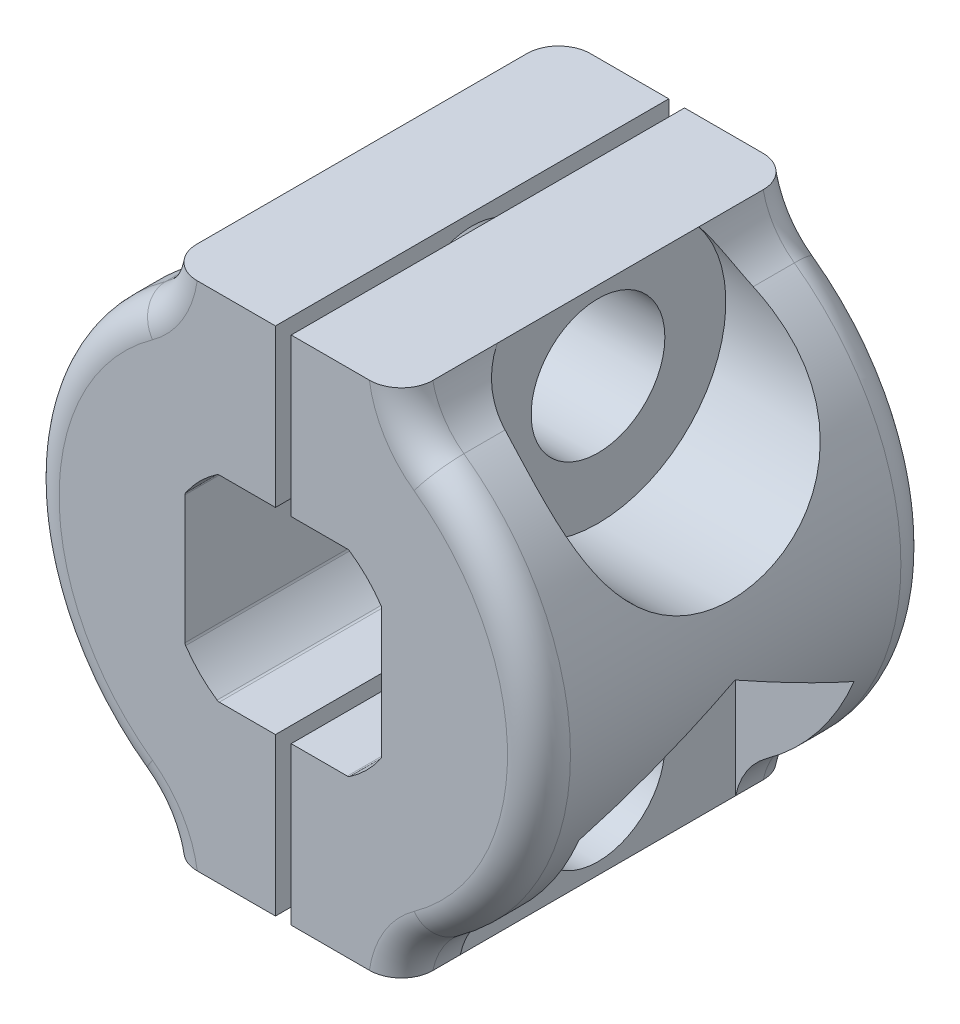
from build123d import *

# Parameters (mm, degrees)
BOSS_EXTRUDE1_DEPTH     = 6.35
CUT_EXTRUDE1_DEPTH      = 14.446415507
CUT_EXTRUDE1_DEPTH_BACK = 14.446415507
SKETCH3_R               = 2.159
CUT_EXTRUDE2_START      = -3.81
SKETCH4_R               = 2.159
CUT_EXTRUDE2_DEPTH      = 12.7
CUT_EXTRUDE3_START      = 3.81
SKETCH4_4_R             = 2.159
CUT_EXTRUDE3_DEPTH      = 12.7
SKETCH6_R               = 4.1275
CUT_EXTRUDE4_DEPTH      = 12.7
SKETCH7_R               = 4.1275
CUT_EXTRUDE5_DEPTH      = 12.7
FILLET1_R               = 2.54
FILLET2_R               = 2.54
FILLET3_R               = 1.016
FILLET4_R               = 1.016


with BuildPart() as part:
    # Sketch2 → Boss-Extrude1 (new, symmetric)
    with BuildSketch(Plane.XY):
        with BuildLine():
            Line((-0.254, 3.175), (-0.254, 8.251091382))
            ThreePointArc((-0.254, 8.251091382), (-2.084293684, 7.987536844), (-3.81, 7.323177248))
            ThreePointArc((-3.81, 7.323177248), (-8.255, 0), (-3.81, -7.323177248))
            ThreePointArc((-3.81, -7.323177248), (-2.084293684, -7.987536844), (-0.254, -8.251091382))
            Line((-0.254, -8.251091382), (-0.254, -3.175))
            Line((-0.254, -3.175), (-2.067410216, -3.175))
            ThreePointArc((-2.067410216, -3.175), (-2.1046987, -3.169402508), (-2.138700223, -3.153103448))
            ThreePointArc((-2.138700223, -3.153103448), (-2.694076836, -2.694076836), (-3.153103448, -2.138700223))
            ThreePointArc((-3.153103448, -2.138700223), (-3.169402508, -2.1046987), (-3.175, -2.067410216))
            Line((-3.175, -2.067410216), (-3.175, 0))
            Line((-3.175, 0), (-3.175, 2.067410216))
            ThreePointArc((-3.175, 2.067410216), (-3.169402508, 2.1046987), (-3.153103448, 2.138700223))
            ThreePointArc((-3.153103448, 2.138700223), (-2.694076836, 2.694076836), (-2.138700223, 3.153103448))
            ThreePointArc((-2.138700223, 3.153103448), (-2.1046987, 3.169402508), (-2.067410216, 3.175))
            Line((-2.067410216, 3.175), (-0.254, 3.175))
        make_face()
        with BuildLine():
            ThreePointArc((3.81, 7.323177248), (2.084293684, 7.987536844), (0.254, 8.251091382))
            Line((0.254, 8.251091382), (0.254, 3.175))
            Line((0.254, 3.175), (2.067410216, 3.175))
            ThreePointArc((2.067410216, 3.175), (2.1046987, 3.169402508), (2.138700223, 3.153103448))
            ThreePointArc((2.138700223, 3.153103448), (2.694076836, 2.694076836), (3.153103448, 2.138700223))
            ThreePointArc((3.153103448, 2.138700223), (3.169402508, 2.1046987), (3.175, 2.067410216))
            Line((3.175, 2.067410216), (3.175, 0))
            Line((3.175, 0), (3.175, -2.067410216))
            ThreePointArc((3.175, -2.067410216), (3.169402508, -2.1046987), (3.153103448, -2.138700223))
            ThreePointArc((3.153103448, -2.138700223), (2.694076836, -2.694076836), (2.138700223, -3.153103448))
            ThreePointArc((2.138700223, -3.153103448), (2.1046987, -3.169402508), (2.067410216, -3.175))
            Line((2.067410216, -3.175), (0.254, -3.175))
            Line((0.254, -3.175), (0.254, -8.251091382))
            ThreePointArc((0.254, -8.251091382), (2.084293684, -7.987536844), (3.81, -7.323177248))
            ThreePointArc((3.81, -7.323177248), (7.05679017, -4.283309176), (8.255, 0))
            ThreePointArc((8.255, 0), (7.05679017, 4.283309176), (3.81, 7.323177248))
        make_face()
        with BuildLine():
            Line((3.81, 8.251091382), (0.254, 8.251091382))
            ThreePointArc((0.254, 8.251091382), (2.084293684, 7.987536844), (3.81, 7.323177248))
            Line((3.81, 7.323177248), (3.81, 8.251091382))
        make_face()
        with BuildLine():
            ThreePointArc((-3.81, 7.323177248), (-2.084293684, 7.987536844), (-0.254, 8.251091382))
            Line((-0.254, 8.251091382), (-3.81, 8.251091382))
            Line((-3.81, 8.251091382), (-3.81, 7.323177248))
        make_face()
        with BuildLine():
            ThreePointArc((-0.254, -8.251091382), (-2.084293684, -7.987536844), (-3.81, -7.323177248))
            Line((-3.81, -7.323177248), (-3.81, -8.251091382))
            Line((-3.81, -8.251091382), (-0.254, -8.251091382))
        make_face()
        with BuildLine():
            ThreePointArc((3.81, -7.323177248), (2.084293684, -7.987536844), (0.254, -8.251091382))
            Line((0.254, -8.251091382), (3.81, -8.251091382))
            Line((3.81, -8.251091382), (3.81, -7.323177248))
        make_face()
    extrude(amount=BOSS_EXTRUDE1_DEPTH, both=True)

    # Sketch3 → Cut-Extrude1 (cut, two sides: drawn at the far end of the back side and taken through both)
    with BuildSketch(Plane(origin=(-0.254, 0, 0), x_dir=(0, 0, -1), z_dir=(1, 0, 0)).offset(-CUT_EXTRUDE1_DEPTH_BACK)):
        with BuildLine():
            ThreePointArc((2.159, 5.713045691), (1.526643541, 7.239689232), (0, 7.872045691))
            Line((0, 7.872045691), (0, 3.554045691))
            ThreePointArc((0, 3.554045691), (1.526643541, 4.186402151), (2.159, 5.713045691))
        make_face()
        with BuildLine():
            Line((0, 3.554045691), (0, 7.872045691))
            ThreePointArc((0, 7.872045691), (-2.159, 5.713045691), (0, 3.554045691))
        make_face()
        with Locations((0, -5.713045691)):
            Circle(SKETCH3_R)
    extrude(amount=CUT_EXTRUDE1_DEPTH + CUT_EXTRUDE1_DEPTH_BACK, mode=Mode.SUBTRACT)

    # Sketch4 → Cut-Extrude2 (cut)
    with BuildSketch(Plane(origin=(0, 0, 0), x_dir=(0, 0, -1), z_dir=(1, 0, 0)).offset(CUT_EXTRUDE2_START)):
        Polygon((0, 10.845689584), (-4.445, 8.279367638), (-4.445, 3.146723745), (0, 0.580401798), (4.445, 3.146723745), (4.445, 8.279367638), align=None)
        with Locations((0, 5.713045691)):
            Circle(SKETCH4_R, mode=Mode.SUBTRACT)
    extrude(amount=-CUT_EXTRUDE2_DEPTH, mode=Mode.SUBTRACT)

    # Sketch4<4> → Cut-Extrude3 (cut)
    with BuildSketch(Plane(origin=(0, 0, 0), x_dir=(0, 0, -1), z_dir=(1, 0, 0)).offset(CUT_EXTRUDE3_START)):
        Polygon((0, -10.845689584), (-4.445, -8.279367638), (-4.445, -3.146723745), (0, -0.580401798), (4.445, -3.146723745), (4.445, -8.279367638), align=None)
        with Locations((0, -5.713045691)):
            Circle(SKETCH4_4_R, mode=Mode.SUBTRACT)
    extrude(amount=CUT_EXTRUDE3_DEPTH, mode=Mode.SUBTRACT)

    # Sketch6 → Cut-Extrude4 (cut)
    with BuildSketch(Plane(origin=(3.81, 0, 0), x_dir=(0, 0, -1), z_dir=(1, 0, 0))):
        with Locations((0, 5.713045691)):
            Circle(SKETCH6_R)
    extrude(amount=CUT_EXTRUDE4_DEPTH, mode=Mode.SUBTRACT)

    # Sketch7 → Cut-Extrude5 (cut)
    with BuildSketch(Plane.ZY.offset(3.81)):
        with Locations((0, -5.713045691)):
            Circle(SKETCH7_R)
    extrude(amount=CUT_EXTRUDE5_DEPTH, mode=Mode.SUBTRACT)

    # Fillet1
    # the kernel refuses this fillet: 2.54 mm, written as the material it adds along each edge
    with BuildSketch(Plane(origin=(-3.81, 7.323177248, -4.445), x_dir=(0, 1, 0), z_dir=(0, 0, -1)), Plane(origin=(-3.81, 7.323177248, 6.35), x_dir=(0, 1, 0), z_dir=(0, 0, -1))) as fillet1_piece_1:
        with BuildLine():
            CenterArc((1.445085875, -2.486791787), FILLET1_R, 101.748195792, 42.568374615)
            Line((-0.618034859, -1.005193719), (-0.659297274, -0.975561758))
            ThreePointArc((-0.659297274, -0.975561758), (-0.334308523, -0.487046845), (-0.045065706, 0.023446154))
            Line((-0.045065706, 0.023446154), (0, 0.0508))
            ThreePointArc((0, 0.0508), (0.463957067, 0.0508), (0.9175707, 0.049735836))
            Line((0.9175707, 0.049735836), (0.927914135, 0))
        make_face()
    extrude(amount=1.905)
    with BuildSketch(Plane(origin=(-3.81, -7.323177248, -6.35), x_dir=(-0.8518647430364081, 0.5237618347794293, 0), z_dir=(0, 0, 1))) as fillet1_piece_2_section:
        with BuildLine():
            CenterArc((1.361529417, 2.533504337), FILLET1_R, 223.333123714, 42.568374615)
            Line((-0.48600601, 0.790457336), (-0.522956718, 0.755596396))
            ThreePointArc((-0.522956718, 0.755596396), (-0.286277734, 0.368621567), (-0.043274729, -0.026607101))
            Line((-0.043274729, -0.026607101), (0.003630745, -0.050670087))
            ThreePointArc((0.003630745, -0.050670087), (0.589996081, -0.029689095), (1.176361416, -0.050670087))
            Line((1.176361416, -0.050670087), (1.179992161, 0))
        make_face()
    fillet1_piece_2 = extrude(amount=5.499489301, mode=Mode.PRIVATE)
    fillet1_piece_2 = fillet1_piece_2 - Plane(origin=(-4.034665627, -5.713045691, 0), x_dir=(0, 0, 1), z_dir=(1, 0, 0)) * Cylinder(4.1275, 16, mode=Mode.PRIVATE)
    add(fillet1_piece_2)
    with BuildSketch(Plane(origin=(-3.81, -7.323177248, 0.850510699), x_dir=(-0.8518647430364114, 0.5237618347794242, 0), z_dir=(0, 0, 1))) as fillet1_piece_3_section:
        with BuildLine():
            CenterArc((1.361529417, 2.533504337), FILLET1_R, 223.333123714, 42.568374615)
            Line((-0.48600601, 0.790457336), (-0.522956718, 0.755596396))
            ThreePointArc((-0.522956718, 0.755596396), (-0.286277734, 0.368621567), (-0.043274729, -0.026607101))
            Line((-0.043274729, -0.026607101), (0.003630745, -0.050670087))
            ThreePointArc((0.003630745, -0.050670087), (0.589996081, -0.029689095), (1.176361416, -0.050670087))
            Line((1.176361416, -0.050670087), (1.179992161, 0))
        make_face()
    fillet1_piece_3 = extrude(amount=5.499489301, mode=Mode.PRIVATE)
    fillet1_piece_3 = fillet1_piece_3 - Plane(origin=(-4.034665565, -5.713045691, 0), x_dir=(0, 0, 1), z_dir=(1, 0, 0)) * Cylinder(4.1275, 16, mode=Mode.PRIVATE)
    add(fillet1_piece_3)

    # Fillet2
    # the kernel refuses this fillet: 2.54 mm, written as the material it adds along each edge
    with BuildSketch(Plane(origin=(3.81, -7.323177248, 4.445), x_dir=(0, -1, 0), z_dir=(0, 0, 1))) as fillet2_piece_1:
        with BuildLine():
            CenterArc((1.445085875, 2.486791787), FILLET2_R, 215.683429593, 42.568374615)
            Line((-0.618034859, 1.005193719), (-0.659297274, 0.975561758))
            ThreePointArc((-0.659297274, 0.975561758), (-0.334308523, 0.487046845), (-0.045065706, -0.023446154))
            Line((-0.045065706, -0.023446154), (0, -0.0508))
            ThreePointArc((0, -0.0508), (0.463957067, -0.0508), (0.9175707, -0.049735836))
            Line((0.9175707, -0.049735836), (0.927914135, 0))
        make_face()
    extrude(amount=1.905)
    with BuildSketch(Plane(origin=(3.81, -7.323177248, -4.445), x_dir=(0.8518647430364108, 0.5237618347794248, 0), z_dir=(0, 0, -1))) as fillet2_piece_2:
        with BuildLine():
            CenterArc((1.361529417, 2.533504337), FILLET2_R, 223.333123714, 42.568374615)
            Line((-0.48600601, 0.790457336), (-0.522956718, 0.755596396))
            ThreePointArc((-0.522956718, 0.755596396), (-0.286277734, 0.368621567), (-0.043274729, -0.026607101))
            Line((-0.043274729, -0.026607101), (0.003630745, -0.050670087))
            ThreePointArc((0.003630745, -0.050670087), (0.589996081, -0.029689095), (1.176361416, -0.050670087))
            Line((1.176361416, -0.050670087), (1.179992161, 0))
        make_face()
    extrude(amount=1.905)
    with BuildSketch(Plane(origin=(3.81, 7.323177248, -0.850510699), x_dir=(0.8518647430364104, -0.5237618347794255, 0), z_dir=(0, 0, -1))) as fillet2_piece_3_section:
        with BuildLine():
            CenterArc((1.361529417, -2.533504337), FILLET2_R, 94.098501671, 42.568374615)
            Line((-0.48600601, -0.790457336), (-0.522956718, -0.755596396))
            ThreePointArc((-0.522956718, -0.755596396), (-0.286277734, -0.368621567), (-0.043274729, 0.026607101))
            Line((-0.043274729, 0.026607101), (0.003630745, 0.050670087))
            ThreePointArc((0.003630745, 0.050670087), (0.589996081, 0.029689095), (1.176361416, 0.050670087))
            Line((1.176361416, 0.050670087), (1.179992161, 0))
        make_face()
    fillet2_piece_3 = extrude(amount=5.499489301, mode=Mode.PRIVATE)
    fillet2_piece_3 = fillet2_piece_3 - Plane(origin=(4.034665627, 5.713045691, 0), x_dir=(0, 0, -1), z_dir=(-1, 0, 0)) * Cylinder(4.1275, 16, mode=Mode.PRIVATE)
    add(fillet2_piece_3)
    with BuildSketch(Plane(origin=(3.81, 7.323177248, 0.850510699), x_dir=(0, 1, 0), z_dir=(0, 0, 1))) as fillet2_piece_4_section:
        with BuildLine():
            CenterArc((1.445085875, -2.486791787), FILLET2_R, 101.748195792, 42.568374615)
            Line((-0.618034859, -1.005193719), (-0.659297274, -0.975561758))
            ThreePointArc((-0.659297274, -0.975561758), (-0.334308523, -0.487046845), (-0.045065706, 0.023446154))
            Line((-0.045065706, 0.023446154), (0, 0.0508))
            ThreePointArc((0, 0.0508), (0.463957067, 0.0508), (0.9175707, 0.049735836))
            Line((0.9175707, 0.049735836), (0.927914135, 0))
        make_face()
    fillet2_piece_4 = extrude(amount=5.499489301, mode=Mode.PRIVATE)
    fillet2_piece_4 = fillet2_piece_4 - Plane(origin=(4.034665565, 5.713045691, 0), x_dir=(0, 0, -1), z_dir=(-1, 0, 0)) * Cylinder(4.1275, 16, mode=Mode.PRIVATE)
    add(fillet2_piece_4)

    # Fillet3
    fillet3_edges = [part.edges().sort_by_distance(p)[0] for p in [
        (8.255, 0, 6.35),
        (8.255, 0, -6.35),
        (4.167350761, -7.383676211, 6.35),
        (4.167350761, -7.383676211, -6.35),
        (4.167350761, 7.383676211, 6.35),
        (4.167350761, 7.383676211, -6.35),
    ]]
    fillet(fillet3_edges, radius=FILLET3_R)

    # Fillet4
    fillet4_edges = [part.edges().sort_by_distance(p)[0] for p in [
        (-8.255, 0, 6.35),
        (-8.255, 0, -6.35),
        (-4.167350761, 7.383676211, -6.35),
        (-4.167350761, 7.383676211, 6.35),
        (-4.167350761, -7.383676211, 6.35),
        (-4.167350761, -7.383676211, -6.35),
    ]]
    fillet(fillet4_edges, radius=FILLET4_R)


solid = part.part
